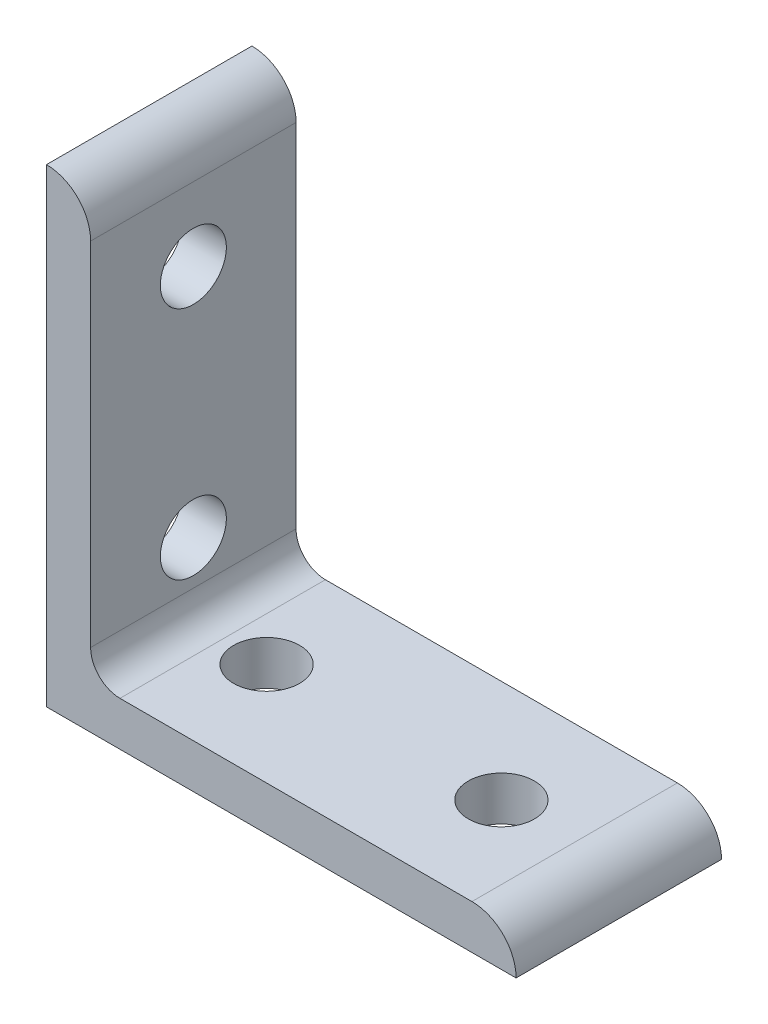
from build123d import *

# Parameters (mm, degrees)
BOSS_EXTRUDE1_DEPTH = 11.1125
SKETCH2_R           = 3.5687
CUT_EXTRUDE1_DEPTH  = 73.696407451
SKETCH3_R           = 3.5687
CUT_EXTRUDE2_DEPTH  = 73.696407451


with BuildPart() as part:
    # Sketch1 → Boss-Extrude1 (new, symmetric)
    with BuildSketch(Plane.XY):
        with BuildLine():
            Line((0, 0), (0, 50.8))
            ThreePointArc((0, 50.8), (3.376576302, 49.401376302), (4.7752, 46.0248))
            Line((4.7752, 46.0248), (4.7752, 7.9502))
            ThreePointArc((4.7752, 7.9502), (5.70513597, 5.70513597), (7.9502, 4.7752))
            Line((7.9502, 4.7752), (46.0248, 4.7752))
            ThreePointArc((46.0248, 4.7752), (49.401376302, 3.376576302), (50.8, 0))
            Line((50.8, 0), (0, 0))
        make_face()
    extrude(amount=BOSS_EXTRUDE1_DEPTH, both=True)

    # Sketch2 → Cut-Extrude1 (cut, through all)
    with BuildSketch(Plane(origin=(0, 0, 0), x_dir=(1, 0, 0), z_dir=(0, 1, 0))):
        with Locations((12.7, 0)):
            Circle(SKETCH2_R)
        with Locations((38.1, 0)):
            Circle(SKETCH2_R)
    extrude(amount=CUT_EXTRUDE1_DEPTH, mode=Mode.SUBTRACT)

    # Sketch3 → Cut-Extrude2 (cut, through all)
    with BuildSketch(Plane(origin=(0, 0, 0), x_dir=(0, 0, -1), z_dir=(1, 0, 0))):
        with Locations((0, 12.7)):
            Circle(SKETCH3_R)
        with Locations((0, 38.1)):
            Circle(SKETCH3_R)
    extrude(amount=CUT_EXTRUDE2_DEPTH, mode=Mode.SUBTRACT)


solid = part.part
